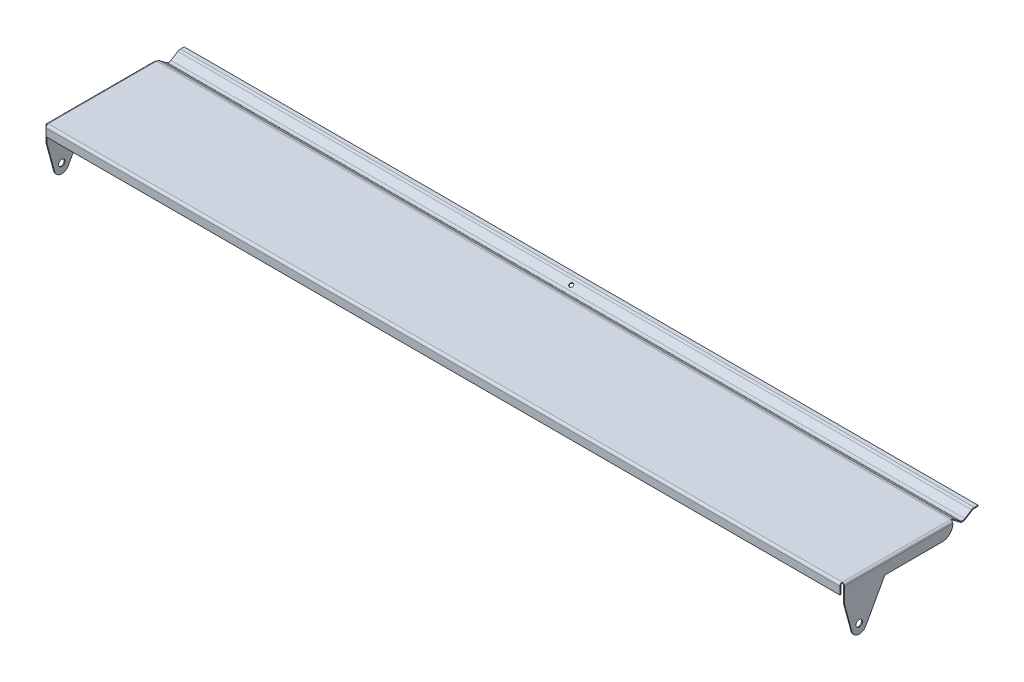
from build123d import *

# Parameters (mm, degrees)
SKETCH1_W                    = 615
SKETCH1_H                    = 105
BASE_FLANGE1_DEPTH           = 0.75
EDGE_FLANGE1_STRIP_W         = 5
EDGE_FLANGE1_STRIP_H         = 0.75
EDGE_FLANGE1_STRIP_CUT_DEPTH = 615
EDGE_FLANGE1_DEPTH           = 615
SKETCH16_W                   = 615
SKETCH16_H                   = 196.52545168
CUT_EXTRUDE1_DEPTH           = 10
SWEPT_START                  = -307.5
SWEPT_FLANGE1_DEPTH          = 615
EDGE_FLANGE2_DEPTH           = 84
EDGE_FLANGE2_BEND_DEPTH      = 84
CUT_EXTRUDE2_DEPTH           = 623.102383053
CUT_EXTRUDE2_DEPTH_BACK      = 623.102383053
SKETCH39_R                   = 2.5
FILLET1_R                    = 8
SKETCH40_R                   = 1.5
CUT_EXTRUDE3_DEPTH           = 10


# Read off the part's stored shape, not the designer's step: Swept Flange1
# Sheet-metal steps are written as plain solids
with BuildPart() as part:
    # Sketch1 → Base-Flange1 (new body)
    with BuildSketch(Plane(origin=(0, 0, 0), x_dir=(1, 0, 0), z_dir=(0, 1, 0))):
        Rectangle(SKETCH1_W, SKETCH1_H)
    extrude(amount=-BASE_FLANGE1_DEPTH)

    # Edge-Flange1 strip (across the edge) → Edge-Flange1 strip cut (cut)
    with BuildSketch(Plane(origin=(307.5, -0.75, 52.5), x_dir=(0, 0, -1), z_dir=(-1, 0, 0))):
        with Locations((-1.5, -0.375)):
            Rectangle(EDGE_FLANGE1_STRIP_W, EDGE_FLANGE1_STRIP_H)
    extrude(amount=EDGE_FLANGE1_STRIP_CUT_DEPTH, mode=Mode.SUBTRACT)

    # Edge-Flange1 section (across the edge) → Edge-Flange1 (add)
    with BuildSketch(Plane(origin=(307.5, -0.75, 52.5), x_dir=(0, 0, -1), z_dir=(-1, 0, 0))):
        with BuildLine():
            Line((-0.75, 1), (-0.75, 7))
            Line((-0.75, 7), (0, 7))
            Line((0, 7), (0, 1))
            ThreePointArc((0, 1), (0.292893219, 0.292893219), (1, 0))
            Line((1, 0), (1, -0.75))
            ThreePointArc((1, -0.75), (-0.237436867, -0.237436867), (-0.75, 1))
        make_face()
    extrude(amount=EDGE_FLANGE1_DEPTH)

    # Sketch16 → Cut-Extrude1 (cut)
    with BuildSketch(Plane(origin=(0, 0, 0), x_dir=(1, 0, 0), z_dir=(0, 1, 0))):
        with Locations((0, 130.76272584)):
            Rectangle(SKETCH16_W, SKETCH16_H)
    extrude(amount=-CUT_EXTRUDE1_DEPTH, mode=Mode.SUBTRACT)

    # Swept Flange1 outline → Swept Flange1 (add)
    with BuildSketch(Plane.YZ.offset(SWEPT_START)):
        with BuildLine():
            Line((-1.7, -50.834586207), (-1.7, -53.75))
            Line((-1.7, -53.75), (-0.95, -53.75))
            Line((-0.95, -53.75), (-0.95, -50.834586207))
            ThreePointArc((-0.95, -50.834586207), (-1.097642895, -49.792701719), (-1.528945753, -48.832858214))
            Line((-1.528945753, -48.832858214), (-4.896680845, -43.497832325))
            ThreePointArc((-4.896680845, -43.497832325), (-5.357412506, -41.775852388), (-4.759837447, -40.09644993))
            Line((-4.759837447, -40.09644993), (-0.75, -34.75))
            ThreePointArc((-0.75, -34.75), (-0.192437632, -33.685854123), (0, -32.5))
            Line((0, -32.5), (-0.75, -32.5))
            ThreePointArc((-0.75, -32.5), (-0.903950106, -33.448683298), (-1.35, -34.3))
            Line((-1.35, -34.3), (-5.359837447, -39.64644993))
            ThreePointArc((-5.359837447, -39.64644993), (-6.106806271, -41.745703002), (-5.530891695, -43.898177923))
            Line((-5.530891695, -43.898177923), (-2.163156602, -49.233203812))
            ThreePointArc((-2.163156602, -49.233203812), (-1.818114316, -50.001078617), (-1.7, -50.834586207))
        make_face()
    extrude(amount=SWEPT_FLANGE1_DEPTH)

    # Edge-Flange2 section (across the edge) → Edge-Flange2 (add)
    with BuildSketch(Plane(origin=(308.5, -0.75, -32.5), x_dir=(-1, 0, 0), z_dir=(0, 0, 1))):
        with BuildLine():
            Line((-0.75, 1), (-0.75, 39))
            Line((-0.75, 39), (0, 39))
            Line((0, 39), (0, 1))
            ThreePointArc((0, 1), (0.292893219, 0.292893219), (1, 0))
            Line((1, 0), (1, -0.75))
            ThreePointArc((1, -0.75), (-0.237436867, -0.237436867), (-0.75, 1))
        make_face()
    extrude(amount=EDGE_FLANGE2_DEPTH)

    # Edge-Flange2 section 2 (across the edge) → Edge-Flange2 bend (add)
    with BuildSketch(Plane(origin=(-308.5, -0.75, 51.5), x_dir=(1, 0, 0), z_dir=(0, 0, -1))):
        with BuildLine():
            Line((-0.75, 1), (-0.75, 39))
            Line((-0.75, 39), (0, 39))
            Line((0, 39), (0, 1))
            ThreePointArc((0, 1), (0.292893219, 0.292893219), (1, 0))
            Line((1, 0), (1, -0.75))
            ThreePointArc((1, -0.75), (-0.237436867, -0.237436867), (-0.75, 1))
        make_face()
    extrude(amount=EDGE_FLANGE2_BEND_DEPTH)

    # Sketch39 → Cut-Extrude2 (cut, two sides: drawn at the far end of the back side and taken through both)
    with BuildSketch(Plane.ZY.offset(309.25).offset(-CUT_EXTRUDE2_DEPTH_BACK)):
        with Locations(Location((40, -32.5, 0), (0, 0, 90))):
            Circle(SKETCH39_R)
        with BuildLine():
            Line((-32.5, -10), (20.187006795, -10))
            Line((20.187006795, -10), (34.931706284, -36.756092926))
            ThreePointArc((34.931706284, -36.756092926), (37.056741569, -38.945618932), (40, -39.75))
            ThreePointArc((40, -39.75), (43.515434794, -38.559838948), (45.58487621, -35.47890121))
            Line((45.58487621, -35.47890121), (51.5, -13.685469847))
            Line((51.5, -13.685469847), (60.41713226, -13.685469847))
            Line((60.41713226, -13.685469847), (60.41713226, -59.649041705))
            Line((60.41713226, -59.649041705), (-51.871278106, -59.649041705))
            Line((-51.871278106, -59.649041705), (-51.871278106, -10))
            Line((-51.871278106, -10), (-32.5, -10))
        make_face()
    extrude(amount=CUT_EXTRUDE2_DEPTH + CUT_EXTRUDE2_DEPTH_BACK, mode=Mode.SUBTRACT)

    # Fillet1
    fillet1_edges = [part.edges().sort_by_distance(p)[0] for p in [
        (308.875, -10, -32.5),
        (-308.875, -10, -32.5),
    ]]
    fillet(fillet1_edges, radius=FILLET1_R)

    # Sketch40 → Cut-Extrude3 (cut)
    with BuildSketch(Plane(origin=(0, -23.135666601, -14.604389542), x_dir=(1, 0, 0), z_dir=(0, 0.8456144659552722, 0.5337941316342656))):
        with Locations(Location((0, 37.3231029, 0), (0, 0, 270))):
            Circle(SKETCH40_R)
    extrude(amount=-CUT_EXTRUDE3_DEPTH, mode=Mode.SUBTRACT)


solid = part.part
